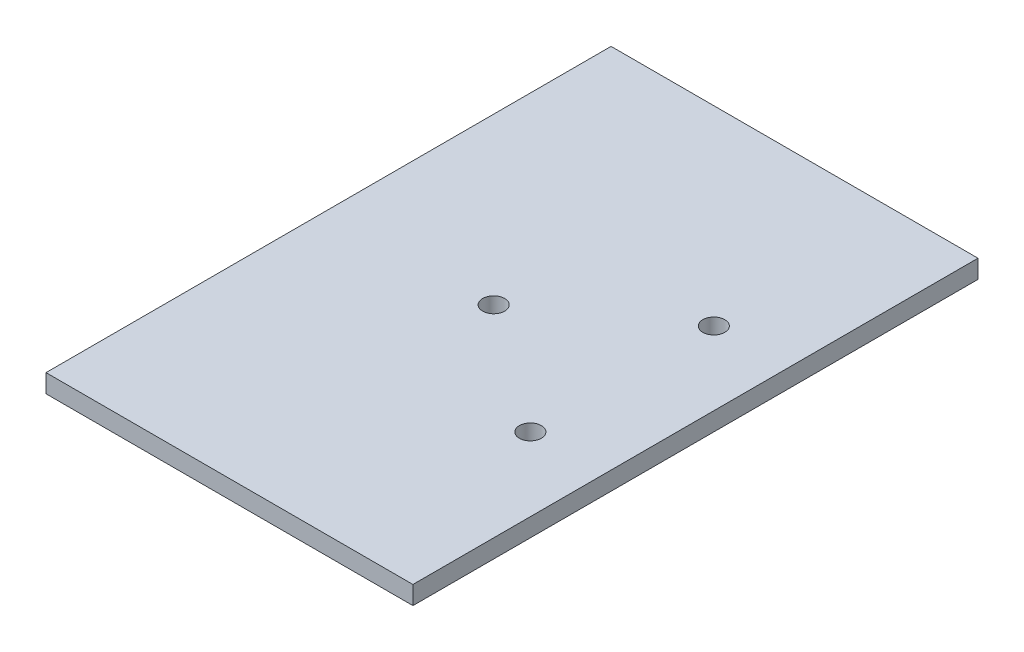
from build123d import *

# Parameters (mm, degrees)
SKETCH1_W           = 100
SKETCH1_H           = 154
SKETCH1_R           = 3
BOSS_EXTRUDE1_DEPTH = 5


with BuildPart() as part:
    # Sketch1 → Boss-Extrude1 (new body)
    with BuildSketch(Plane(origin=(0, 0, 0), x_dir=(1, 0, 0), z_dir=(0, 1, 0))):
        with Locations((23.349056604, 51.646226415)):
            Rectangle(SKETCH1_W, SKETCH1_H)
        with Locations((18.349056604, 51.646226415)):
            Circle(SKETCH1_R, mode=Mode.SUBTRACT)
        with Locations((53.349056604, 76.646226415)):
            Circle(SKETCH1_R, mode=Mode.SUBTRACT)
        with Locations((53.349056604, 26.646226415)):
            Circle(SKETCH1_R, mode=Mode.SUBTRACT)
    extrude(amount=BOSS_EXTRUDE1_DEPTH)


solid = part.part
